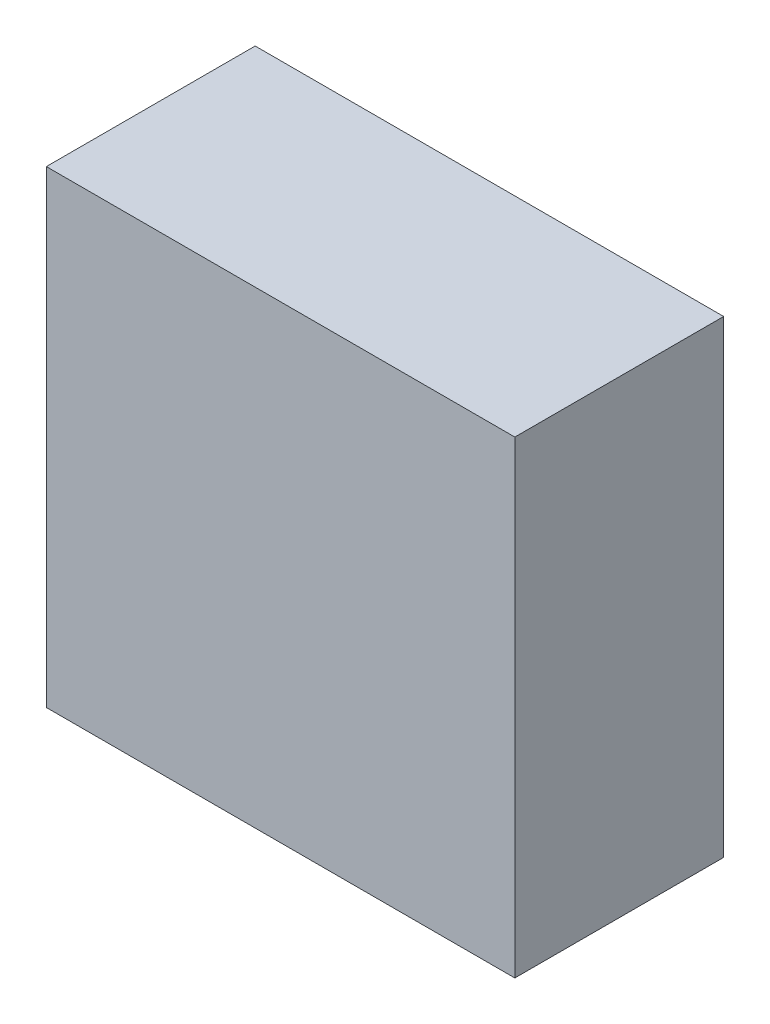
from build123d import *

# Parameters (mm, degrees)
SKETCH1_W           = 59
SKETCH1_H           = 59
BOSS_EXTRUDE1_DEPTH = 26.3


with BuildPart() as part:
    # Sketch1 → Boss-Extrude1 (new body)
    with BuildSketch(Plane.XY):
        with Locations((29.5, 29.5)):
            Rectangle(SKETCH1_W, SKETCH1_H)
    extrude(amount=BOSS_EXTRUDE1_DEPTH)


solid = part.part
